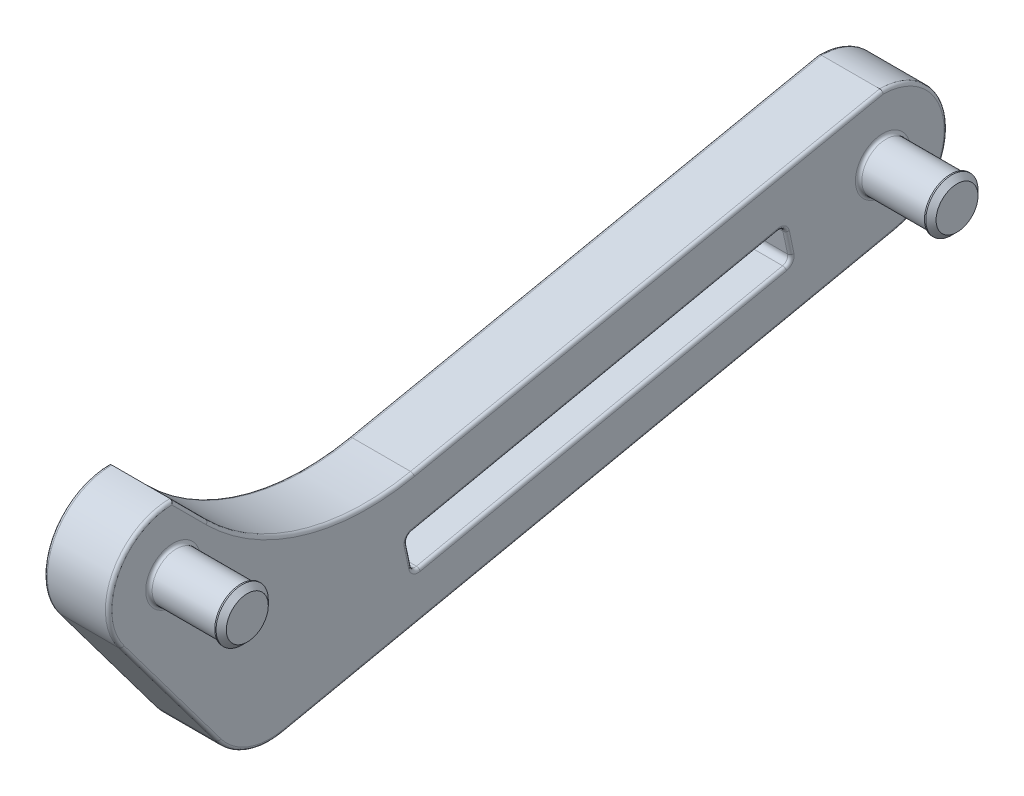
from build123d import *

# Parameters (mm, degrees)
SKETCH_1_R          = 3.75
EXTRUDE_1_DEPTH     = 10
SKETCH_2_R          = 3.75
SKETCH_2_R_2        = 3.750000000000006
EXTRUDE_2_DEPTH     = 10
EXTRUDE_3_DEPTH     = 10
CUT_EXTRUDE_1_DEPTH = 126.29964086141668
CUT_EXTRUDE_2_DEPTH = 10
FILLET_1_R          = 1
EXTRUDE_START       = 0.5
SKETCH_6_R          = 3.750000000000006
SKETCH_6_R_2        = 3.75
EXTRUDE_4_DEPTH     = 0.5
SKETCH_7_R          = 4.0500000000000025
EXTRUDE_5_DEPTH     = 1
CHAMFER_1_SIZE      = 0.8
SKETCH_8_R          = 4.05
EXTRUDE_6_DEPTH     = 1
CHAMFER_2_SIZE      = 0.8
FILLET_3_R          = 0.5


with BuildPart() as part:
    # 草图1 → 凸台-拉伸1 (new body)
    with BuildSketch(Plane(origin=(0, 0, 0), x_dir=(0, 0, -1), z_dir=(1, 0, 0))):
        with BuildLine():
            Line((0, 10), (110, 10))
            ThreePointArc((110, 10), (120, 0), (110, -10))
            Line((110, -10), (0, -10))
            ThreePointArc((0, -10), (-10, 1.22e-15), (0, 10))
        make_face()
        Circle(SKETCH_1_R, mode=Mode.SUBTRACT)
    extrude(amount=EXTRUDE_1_DEPTH)

    # 草图2 → 凸台-拉伸2 (add, symmetric)
    with BuildSketch(Plane(origin=(10, 0, 0), x_dir=(0, 0, -1), z_dir=(1, 0, 0))):
        Circle(SKETCH_2_R)
        with Locations((110, 0)):
            Circle(SKETCH_2_R_2)
    extrude(amount=EXTRUDE_2_DEPTH, both=True)

    # 草图3 → 凸台-拉伸3 (add)
    with BuildSketch(Plane.ZY):
        with BuildLine():
            Line((8, -6), (-6.999999999999996, -26.00000000000001))
            ThreePointArc((-6.999999999999996, -26.00000000000001), (-11.478198300811943, -29.359322239969963), (-17.06010481049842, -29.785497849867504))
            Line((-17.06010481049842, -29.785497849867504), (-112.06010481049843, -9.785497849867493))
            ThreePointArc((-112.06010481049843, -9.785497849867493), (-119.94622990129112, 1.0356209493161885), (-110, 10))
            Line((-110, 10), (6.1e-16, 10))
            ThreePointArc((6.1e-16, 10), (8.94427190999916, 4.472135954999579), (8, -6))
        make_face()
    extrude(amount=-EXTRUDE_3_DEPTH)

    # 草图4 → 切除-拉伸1 (cut, through all)
    with BuildSketch(Plane.ZY):
        with BuildLine():
            Line((6.1e-16, 10), (-5.470582889553738, 4.52941711044617))
            ThreePointArc((-5.470582889553738, 4.52941711044617), (-20.178286006408136, -4.250603826537166), (-37.29096271119614, -4.999999999999999))
            Line((-37.29096271119614, -4.999999999999999), (-110, 10))
            Line((-110, 10), (6.1e-16, 10))
        make_face()
    extrude(amount=-CUT_EXTRUDE_1_DEPTH, mode=Mode.SUBTRACT)

    # 草图5 → 切除-拉伸2 (cut)
    with BuildSketch(Plane.ZY):
        Polygon((-37.22679756914334, -18.386435433698402), (-95.9397846683483, -6.025806570707891), (-94.80672702257417, -0.6437827532807727), (-36.09373992336921, -13.00441161627128), align=None)
    extrude(amount=-CUT_EXTRUDE_2_DEPTH, mode=Mode.SUBTRACT)

    # 圆角1
    fillet_1_edges = [part.edges().sort_by_distance(p)[0] for p in [
        (5, -13.00441161627128, -36.09373992336921),
        (5, -18.386435433698402, -37.22679756914334),
        (5, -6.025806570707891, -95.9397846683483),
        (5, -0.6437827532807727, -94.80672702257417),
    ]]
    fillet(fillet_1_edges, radius=FILLET_1_R)

    # 草图6 → 凸台-拉伸4 (add)
    with BuildSketch(Plane(origin=(20, 0, 0), x_dir=(0, 0, -1), z_dir=(1, 0, 0)).offset(EXTRUDE_START)):
        with Locations((110, 0)):
            Circle(SKETCH_6_R)
        Circle(SKETCH_6_R_2)
    extrude(amount=-EXTRUDE_4_DEPTH)

    # 草图7 → 凸台-拉伸5 (add)
    with BuildSketch(Plane(origin=(20.5, 0, 0), x_dir=(0, 0, -1), z_dir=(1, 0, 0))):
        with Locations((110, 0)):
            Circle(SKETCH_7_R)
    extrude(amount=EXTRUDE_5_DEPTH)

    # 倒角1
    chamfer_1_edges = [part.edges().sort_by_distance(p)[0] for p in [
        (21.5, 5e-16, -105.95),
    ]]
    chamfer(chamfer_1_edges, length=CHAMFER_1_SIZE)

    # 草图8 → 凸台-拉伸6 (add)
    with BuildSketch(Plane(origin=(20.5, 0, 0), x_dir=(0, 0, -1), z_dir=(1, 0, 0))):
        Circle(SKETCH_8_R)
    extrude(amount=EXTRUDE_6_DEPTH)

    # 倒角2
    chamfer_2_edges = [part.edges().sort_by_distance(p)[0] for p in [
        (21.5, 5e-16, 4.05),
    ]]
    chamfer(chamfer_2_edges, length=CHAMFER_2_SIZE)

    # 圆角3
    # the kernel refuses this fillet: 0.5 mm, written as the material it adds along each edge
    with BuildSketch(Plane(origin=(10, 0, 0), x_dir=(0, 0, -1), z_dir=(0, -1, 0))) as fillet_3_piece_1:
        with BuildLine():
            CenterArc((3.75 + FILLET_3_R, FILLET_3_R), FILLET_3_R, 180, 90)
            Line((3.75 + FILLET_3_R, 0), (3.75, 0))
            Line((3.75, 0), (3.75, FILLET_3_R))
        make_face()
    revolve(axis=Axis((10, 0, 0), (1, 0, 0)))
    with BuildSketch(Plane(origin=(10, 0, -110), x_dir=(0, 0, -1), z_dir=(0, -1, 0))) as fillet_3_piece_2:
        with BuildLine():
            CenterArc((3.75 + FILLET_3_R, FILLET_3_R), FILLET_3_R, 180, 90)
            Line((3.75, FILLET_3_R), (3.75, 0))
            Line((3.75, 0), (3.75 + FILLET_3_R, 0))
        make_face()
    revolve(axis=Axis((10, 0, -110), (1, 0, 0)))
    # the kernel refuses this fillet: 0.5 mm, written as the material it takes off along each edge
    with BuildSketch(Plane(origin=(0, -1.8283430193173613, -94.03418771863726), x_dir=(0, 0.9785497849867515, 0.20601048104983025), z_dir=(0, -0.20601048104983025, 0.9785497849867515))) as fillet_3_2_piece_1:
        with BuildLine():
            CenterArc((1 + FILLET_3_R, -FILLET_3_R), FILLET_3_R, 90.00000000000007, 89.99999999999994)
            Line((1 + FILLET_3_R, 6e-17), (1, 0))
            Line((1, 0), (0.9999999999999994, -FILLET_3_R))
        make_face()
    revolve(axis=Axis((0, -1.8283430193173613, -94.03418771863726), (-1, 0, 0)), revolution_arc=89.99999999999942, mode=Mode.SUBTRACT)
    with BuildSketch(Plane(origin=(10, -1.8283430193173613, -94.03418771863726), x_dir=(0, 0.9785497849867515, 0.20601048104983025), z_dir=(0, -0.20601048104983025, 0.9785497849867515))) as fillet_3_2_piece_2:
        with BuildLine():
            CenterArc((1 + FILLET_3_R, FILLET_3_R), FILLET_3_R, 180, 90)
            Line((0.9999999999999988, FILLET_3_R), (1, 0))
            Line((1, 0), (1 + FILLET_3_R, 0))
        make_face()
    revolve(axis=Axis((10, -1.8283430193173613, -94.03418771863726), (-1, 0, 0)), revolution_arc=89.99999999999942, mode=Mode.SUBTRACT)
    with BuildSketch(Plane(origin=(0, -8.9e-16, -110), x_dir=(0, 0.992175793893205, 0.12484868446398849), z_dir=(0, -0.12484868446398849, 0.992175793893205))) as fillet_3_2_piece_3:
        with BuildLine():
            CenterArc((9.999999999999998 - FILLET_3_R, -FILLET_3_R), FILLET_3_R, 0, 90)
            Line((9.999999999999998 - FILLET_3_R, 6e-17), (9.999999999999998, 0))
            Line((9.999999999999998, 0), (10.000000000000002, -FILLET_3_R))
        make_face()
    revolve(axis=Axis((0, -8.9e-16, -110), (-1, 0, 0)), revolution_arc=175.28335954758495, mode=Mode.SUBTRACT)
    with BuildSketch(Plane(origin=(10, -8.9e-16, -110), x_dir=(0, 0.992175793893205, 0.12484868446398853), z_dir=(0, -0.12484868446398853, 0.992175793893205))) as fillet_3_2_piece_4:
        with BuildLine():
            CenterArc((10.000000000000002 - FILLET_3_R, FILLET_3_R), FILLET_3_R, 270, 90)
            Line((10.000000000000002, FILLET_3_R), (10.000000000000002, 0))
            Line((10.000000000000002, 0), (10.000000000000002 - FILLET_3_R, 0))
        make_face()
    revolve(axis=Axis((10, -8.9e-16, -110), (-1, 0, 0)), revolution_arc=175.28335954758495, mode=Mode.SUBTRACT)
    with BuildSketch(Plane(origin=(0, -29.785497849867504, -17.06010481049842), x_dir=(1, 0, 0), z_dir=(0, 0.206010481049842, -0.978549784986749))) as fillet_3_2_piece_5:
        with BuildLine():
            CenterArc((FILLET_3_R, -FILLET_3_R), FILLET_3_R, 90, 89.99999999999991)
            Line((-6e-17, -FILLET_3_R), (0, 0))
            Line((0, 0), (FILLET_3_R, 0))
        make_face()
    extrude(amount=97.08243919473801, mode=Mode.SUBTRACT)
    with BuildSketch(Plane(origin=(0, -19.999999999999993, -15.000000000000004), x_dir=(0, -0.600000000000001, 0.7999999999999994), z_dir=(0, 0.7999999999999994, 0.600000000000001))) as fillet_3_2_piece_6:
        with BuildLine():
            CenterArc((10.000000000000021 - FILLET_3_R, FILLET_3_R), FILLET_3_R, 270.0000000000004, 89.9999999999996)
            Line((10.000000000000021 - FILLET_3_R, -6e-17), (10.000000000000021, 0))
            Line((10.000000000000021, 0), (10.00000000000002, FILLET_3_R))
        make_face()
    revolve(axis=Axis((0, -19.999999999999993, -15.000000000000004), (1, 0, 0)), revolution_arc=65.01876039378385, mode=Mode.SUBTRACT)
    with BuildSketch(Plane(origin=(0, -6, 8), x_dir=(1, 0, 0), z_dir=(0, -0.8000000000000003, -0.5999999999999998))) as fillet_3_2_piece_7:
        with BuildLine():
            CenterArc((FILLET_3_R, -FILLET_3_R), FILLET_3_R, 90, 89.99999999999986)
            Line((-6e-17, -FILLET_3_R), (0, 0))
            Line((0, 0), (FILLET_3_R, 0))
        make_face()
    extrude(amount=25.000000000000007, mode=Mode.SUBTRACT)
    with BuildSketch(Plane(origin=(10, -6, 8), x_dir=(0, 0.5999999999999998, -0.8000000000000003), z_dir=(0, -0.8000000000000003, -0.5999999999999998))) as fillet_3_2_piece_8:
        with BuildLine():
            CenterArc((FILLET_3_R, -FILLET_3_R), FILLET_3_R, 90, 90)
            Line((-1.95e-15, -FILLET_3_R), (0, 0))
            Line((0, 0), (FILLET_3_R, 0))
        make_face()
    extrude(amount=25.000000000000007, mode=Mode.SUBTRACT)
    with BuildSketch(Plane(origin=(10, -19.999999999999993, -15.000000000000004), x_dir=(0, -0.600000000000001, 0.7999999999999994), z_dir=(0, 0.7999999999999994, 0.600000000000001))) as fillet_3_2_piece_9:
        with BuildLine():
            CenterArc((10.000000000000021 - FILLET_3_R, -FILLET_3_R), FILLET_3_R, 0, 90)
            Line((10.000000000000023, -FILLET_3_R), (10.000000000000021, 0))
            Line((10.000000000000021, 0), (10.000000000000021 - FILLET_3_R, 0))
        make_face()
    revolve(axis=Axis((10, -19.999999999999993, -15.000000000000004), (1, 0, 0)), revolution_arc=65.01876039378385, mode=Mode.SUBTRACT)
    with BuildSketch(Plane(origin=(10, -29.785497849867504, -17.06010481049842), x_dir=(0, 0.9785497849867489, 0.20601048104984196), z_dir=(0, 0.206010481049842, -0.978549784986749))) as fillet_3_2_piece_10:
        with BuildLine():
            CenterArc((FILLET_3_R, -FILLET_3_R), FILLET_3_R, 90, 90)
            Line((0, -FILLET_3_R), (0, 0))
            Line((0, 0), (FILLET_3_R, 0))
        make_face()
    extrude(amount=97.08243919473801, mode=Mode.SUBTRACT)
    with BuildSketch(Plane(origin=(10, 0, 0), x_dir=(0, -0.5999999999999998, 0.8000000000000002), z_dir=(0, -0.8000000000000002, -0.5999999999999998))) as fillet_3_2_piece_11:
        with BuildLine():
            CenterArc((10 - FILLET_3_R, FILLET_3_R), FILLET_3_R, 270, 90)
            Line((10, FILLET_3_R), (10, 0))
            Line((10, 0), (10 - FILLET_3_R, 0))
        make_face()
    revolve(axis=Axis((10, 0, 0), (-1, 0, 0)), revolution_arc=134.0375887678595, mode=Mode.SUBTRACT)
    with BuildSketch(Plane(origin=(10, 29.27815445197507, -30.219320231083113), x_dir=(0, -0.979375841485003, -0.2020469280032294), z_dir=(0, 0.2020469280032294, -0.979375841485003))) as fillet_3_2_piece_12:
        with BuildLine():
            CenterArc((34.99999999999997 + FILLET_3_R, FILLET_3_R), FILLET_3_R, 180, 90)
            Line((34.99999999999997, FILLET_3_R), (34.99999999999997, 0))
            Line((34.99999999999997, 0), (34.99999999999997 + FILLET_3_R, 0))
        make_face()
    revolve(axis=Axis((10, 29.27815445197507, -30.219320231083113), (-1, 0, 0)), revolution_arc=56.65668339446086, mode=Mode.SUBTRACT)
    with BuildSketch(Plane(origin=(10, 10.883883476483195, 0.8838834764831773), x_dir=(0, -0.7071067811865417, 0.7071067811865535), z_dir=(0, -0.7071067811865535, -0.7071067811865416))) as fillet_3_2_piece_13:
        with BuildLine():
            CenterArc((FILLET_3_R, FILLET_3_R), FILLET_3_R, 180, 90)
            Line((-1.6e-16, FILLET_3_R), (0, 0))
            Line((0, 0), (FILLET_3_R, 0))
        make_face()
    extrude(amount=8.986572516493158, mode=Mode.SUBTRACT)
    with BuildSketch(Plane(origin=(10, -5, -37.29096271119614), x_dir=(0, -0.9793758414850032, -0.20204692800322901), z_dir=(0, 0.20204692800322901, -0.9793758414850032))) as fillet_3_2_piece_14:
        with BuildLine():
            CenterArc((FILLET_3_R, FILLET_3_R), FILLET_3_R, 180, 90)
            Line((0, FILLET_3_R), (0, 0))
            Line((0, 0), (FILLET_3_R, 0))
        make_face()
    extrude(amount=75.49017849833521, mode=Mode.SUBTRACT)
    with BuildSketch(Plane(origin=(0, -4.999999999999999, -37.29096271119614), x_dir=(1, 0, 0), z_dir=(0, 0.202046928003229, -0.9793758414850031))) as fillet_3_2_piece_15:
        with BuildLine():
            CenterArc((FILLET_3_R, FILLET_3_R), FILLET_3_R, 180, 90)
            Line((-6e-17, FILLET_3_R), (0, 0))
            Line((0, 0), (FILLET_3_R, 0))
        make_face()
    extrude(amount=75.49017849833521, mode=Mode.SUBTRACT)
    with BuildSketch(Plane(origin=(0, 29.27815445197507, -30.219320231083113), x_dir=(0, -0.7071067811865408, 0.7071067811865543), z_dir=(0, 0.7071067811865543, 0.7071067811865408))) as fillet_3_2_piece_16:
        with BuildLine():
            CenterArc((34.99999999999997 + FILLET_3_R, FILLET_3_R), FILLET_3_R, 180, 90)
            Line((34.99999999999997 + FILLET_3_R, -6e-17), (34.99999999999997, 0))
            Line((34.99999999999997, 0), (34.99999999999997, FILLET_3_R))
        make_face()
    revolve(axis=Axis((0, 29.27815445197507, -30.219320231083113), (1, 0, 0)), revolution_arc=56.65668339446088, mode=Mode.SUBTRACT)
    with BuildSketch(Plane(origin=(0, 10.883883476483192, 0.8838834764831777), x_dir=(1, -2.2e-16, 2.2e-16), z_dir=(0, -0.7071067811865535, -0.7071067811865416))) as fillet_3_2_piece_17:
        with BuildLine():
            CenterArc((FILLET_3_R, FILLET_3_R), FILLET_3_R, 180.00000000000003, 89.99999999999994)
            Line((1e-16, FILLET_3_R), (0, 0))
            Line((0, 0), (FILLET_3_R, 0))
        make_face()
    extrude(amount=8.986572516493156, mode=Mode.SUBTRACT)
    with BuildSketch(Plane(origin=(0, 0, 0), x_dir=(0, -0.5999999999999998, 0.8000000000000002), z_dir=(0, -0.8000000000000002, -0.5999999999999998))) as fillet_3_2_piece_18:
        with BuildLine():
            CenterArc((10 - FILLET_3_R, -FILLET_3_R), FILLET_3_R, 0, 90)
            Line((10 - FILLET_3_R, 6e-17), (10, 0))
            Line((10, 0), (10, -FILLET_3_R))
        make_face()
    revolve(axis=Axis((0, 0, 0), (-1, 0, 0)), revolution_arc=134.0375887678595, mode=Mode.SUBTRACT)
    with BuildSketch(Plane(origin=(0, -0.8497932343306142, -93.82817723758741), x_dir=(1, -2.1e-16, -4e-17), z_dir=(0, -0.20601048104984176, 0.978549784986749))) as fillet_3_2_piece_19:
        with BuildLine():
            CenterArc((FILLET_3_R, FILLET_3_R), FILLET_3_R, 180, 90)
            Line((-1.6e-16, FILLET_3_R), (0, 0))
            Line((0, 0), (FILLET_3_R, 0))
        make_face()
    extrude(amount=58.00000000000001, mode=Mode.SUBTRACT)
    with BuildSketch(Plane(origin=(10, -0.8497932343306142, -93.82817723758741), x_dir=(0, 0.978549784986749, 0.20601048104984176), z_dir=(0, -0.20601048104984176, 0.978549784986749))) as fillet_3_2_piece_20:
        with BuildLine():
            CenterArc((FILLET_3_R, FILLET_3_R), FILLET_3_R, 180, 90)
            Line((2.2e-16, FILLET_3_R), (0, 0))
            Line((0, 0), (FILLET_3_R, 0))
        make_face()
    extrude(amount=58.00000000000001, mode=Mode.SUBTRACT)
    with BuildSketch(Plane(origin=(0, -13.98296140125803, -36.29975040441906), x_dir=(1, 1.5e-16, -7.2e-16), z_dir=(0, -0.978549784986749, -0.20601048104984176))) as fillet_3_2_piece_21:
        with BuildLine():
            CenterArc((FILLET_3_R, FILLET_3_R), FILLET_3_R, 180, 90.00000000000006)
            Line((-4.2e-16, FILLET_3_R), (0, 0))
            Line((0, 0), (FILLET_3_R, 0))
        make_face()
    extrude(amount=3.4999999999999982, mode=Mode.SUBTRACT)
    with BuildSketch(Plane(origin=(10, -13.98296140125803, -36.29975040441906), x_dir=(0, -0.20601048104984174, 0.978549784986749), z_dir=(0, -0.978549784986749, -0.20601048104984176))) as fillet_3_2_piece_22:
        with BuildLine():
            CenterArc((FILLET_3_R, FILLET_3_R), FILLET_3_R, 180, 90)
            Line((-3.7e-16, FILLET_3_R), (0, 0))
            Line((0, 0), (FILLET_3_R, 0))
        make_face()
    extrude(amount=3.4999999999999982, mode=Mode.SUBTRACT)
    with BuildSketch(Plane(origin=(0, -18.180424952648558, -38.2053473541301), x_dir=(1, 0, 0), z_dir=(0, 0.20601048104984182, -0.978549784986749))) as fillet_3_2_piece_23:
        with BuildLine():
            CenterArc((FILLET_3_R, FILLET_3_R), FILLET_3_R, 180, 90)
            Line((-6e-17, FILLET_3_R), (0, 0))
            Line((0, 0), (FILLET_3_R, 0))
        make_face()
    extrude(amount=58.000000000000014, mode=Mode.SUBTRACT)
    with BuildSketch(Plane(origin=(10, -18.180424952648558, -38.2053473541301), x_dir=(0, -0.978549784986749, -0.20601048104984182), z_dir=(0, 0.20601048104984182, -0.978549784986749))) as fillet_3_2_piece_24:
        with BuildLine():
            CenterArc((FILLET_3_R, FILLET_3_R), FILLET_3_R, 180, 90)
            Line((0, FILLET_3_R), (0, 0))
            Line((0, 0), (FILLET_3_R, 0))
        make_face()
    extrude(amount=58.000000000000014, mode=Mode.SUBTRACT)
    with BuildSketch(Plane(origin=(0, -5.047256785721146, -95.73377418729845), x_dir=(1, 0, 0), z_dir=(0, 0.978549784986749, 0.2060104810498419))) as fillet_3_2_piece_25:
        with BuildLine():
            CenterArc((FILLET_3_R, FILLET_3_R), FILLET_3_R, 180, 90)
            Line((-6e-17, FILLET_3_R), (0, 0))
            Line((0, 0), (FILLET_3_R, 0))
        make_face()
    extrude(amount=3.5000000000000036, mode=Mode.SUBTRACT)
    with BuildSketch(Plane(origin=(10, -5.047256785721146, -95.73377418729845), x_dir=(0, 0.20601048104984193, -0.978549784986749), z_dir=(0, 0.978549784986749, 0.2060104810498419))) as fillet_3_2_piece_26:
        with BuildLine():
            CenterArc((FILLET_3_R, FILLET_3_R), FILLET_3_R, 180, 90)
            Line((0, FILLET_3_R), (0, 0))
            Line((0, 0), (FILLET_3_R, 0))
        make_face()
    extrude(amount=3.5000000000000036, mode=Mode.SUBTRACT)
    with BuildSketch(Plane(origin=(0, -13.776950920208188, -37.278300189405805), x_dir=(0, -0.20601048104984307, 0.9785497849867488), z_dir=(0, -0.9785497849867488, -0.20601048104984307))) as fillet_3_2_piece_27:
        with BuildLine():
            CenterArc((0.9999999999999981 + FILLET_3_R, -FILLET_3_R), FILLET_3_R, 90, 90)
            Line((0.9999999999999981 + FILLET_3_R, 6e-17), (0.9999999999999981, 0))
            Line((0.9999999999999981, 0), (0.9999999999999981, -FILLET_3_R))
        make_face()
    revolve(axis=Axis((0, -13.776950920208188, -37.278300189405805), (-1, 0, 0)), revolution_arc=89.9999999999999, mode=Mode.SUBTRACT)
    with BuildSketch(Plane(origin=(10, -13.776950920208188, -37.278300189405805), x_dir=(0, -0.20601048104984307, 0.9785497849867488), z_dir=(0, -0.9785497849867488, -0.20601048104984307))) as fillet_3_2_piece_28:
        with BuildLine():
            CenterArc((0.9999999999999981 + FILLET_3_R, FILLET_3_R), FILLET_3_R, 180, 90)
            Line((0.9999999999999981, FILLET_3_R), (0.9999999999999981, 0))
            Line((0.9999999999999981, 0), (0.9999999999999981 + FILLET_3_R, 0))
        make_face()
    revolve(axis=Axis((10, -13.776950920208188, -37.278300189405805), (-1, 0, 0)), revolution_arc=89.9999999999999, mode=Mode.SUBTRACT)
    with BuildSketch(Plane(origin=(0, -17.20187516766181, -37.99933687308025), x_dir=(0, -0.20601048104984135, 0.9785497849867492), z_dir=(0, 0.9785497849867492, 0.20601048104984135))) as fillet_3_2_piece_29:
        with BuildLine():
            CenterArc((0.9999999999999977 + FILLET_3_R, FILLET_3_R), FILLET_3_R, 180, 90)
            Line((0.9999999999999977 + FILLET_3_R, -6e-17), (0.9999999999999977, 0))
            Line((0.9999999999999977, 0), (0.9999999999999977, FILLET_3_R))
        make_face()
    revolve(axis=Axis((0, -17.20187516766181, -37.99933687308025), (1, 0, 0)), revolution_arc=90.00000000000028, mode=Mode.SUBTRACT)
    with BuildSketch(Plane(origin=(10, -17.20187516766181, -37.99933687308025), x_dir=(0, -0.20601048104984135, 0.9785497849867492), z_dir=(0, 0.9785497849867492, 0.20601048104984135))) as fillet_3_2_piece_30:
        with BuildLine():
            CenterArc((0.9999999999999977 + FILLET_3_R, -FILLET_3_R), FILLET_3_R, 90, 90)
            Line((0.9999999999999977, -FILLET_3_R), (0.9999999999999977, 0))
            Line((0.9999999999999977, 0), (0.9999999999999977 + FILLET_3_R, 0))
        make_face()
    revolve(axis=Axis((10, -17.20187516766181, -37.99933687308025), (1, 0, 0)), revolution_arc=90.00000000000028, mode=Mode.SUBTRACT)
    with BuildSketch(Plane(origin=(0, -5.253267266770983, -94.75522440231171), x_dir=(0, 0.20601048104984165, -0.9785497849867492), z_dir=(0, 0.9785497849867492, 0.20601048104984165))) as fillet_3_2_piece_31:
        with BuildLine():
            CenterArc((1.000000000000005 + FILLET_3_R, -FILLET_3_R), FILLET_3_R, 89.9999999999999, 90.00000000000011)
            Line((1.000000000000005 + FILLET_3_R, 6e-17), (1.000000000000005, 0))
            Line((1.000000000000005, 0), (1.000000000000004, -FILLET_3_R))
        make_face()
    revolve(axis=Axis((0, -5.253267266770983, -94.75522440231171), (-1, 0, 0)), revolution_arc=89.99999999999984, mode=Mode.SUBTRACT)
    with BuildSketch(Plane(origin=(10, -5.253267266770983, -94.75522440231171), x_dir=(0, 0.20601048104984165, -0.9785497849867492), z_dir=(0, 0.9785497849867492, 0.20601048104984165))) as fillet_3_2_piece_32:
        with BuildLine():
            CenterArc((1.000000000000005 + FILLET_3_R, FILLET_3_R), FILLET_3_R, 180, 90)
            Line((1.000000000000004, FILLET_3_R), (1.000000000000005, 0))
            Line((1.000000000000005, 0), (1.000000000000005 + FILLET_3_R, 0))
        make_face()
    revolve(axis=Axis((10, -5.253267266770983, -94.75522440231171), (-1, 0, 0)), revolution_arc=89.99999999999984, mode=Mode.SUBTRACT)


solid = part.part
